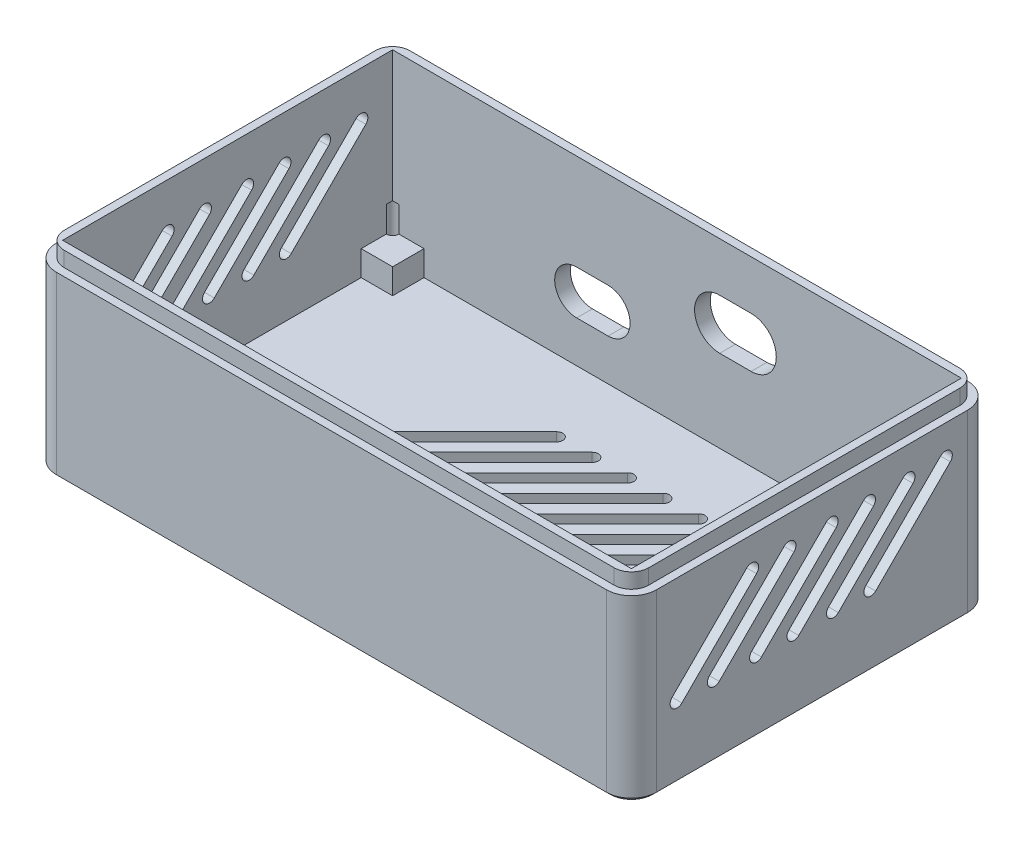
from build123d import *

# Parameters (mm, degrees)
CUERPO_DEPTH                  = 28.5
CROQUIS_HUECO_PCB_W           = 90.5
CROQUIS_HUECO_PCB_H           = 52.5
HUECO_PCB_DEPTH               = 26.5
CROQUIS_LABIO_W               = 90.5
CROQUIS_LABIO_H               = 52.5
LABIO_LIP_DEPTH               = 2.4
CROQUIS_APOYOS_W              = 5
CROQUIS_APOYOS_H              = 5
APOYOS_PCB_DEPTH              = 4
CROQUIS_ALIVIOS_R             = 1
ALIVIOS_ESQUINAS_DEPTH        = 8.1
SALIDAS_USB_Y_PANEL_DEPTH     = 64.729388825
VENTILAS_LATERALES_DEPTH      = 64.729388825
VENTILAS_LATERALES_DEPTH_BACK = 64.729388825
REJILLA_PISO_DEPTH            = 2
CHAFLAN_BASE_SIZE             = 0.6


with BuildPart() as part:
    # Croquis_contorno → Cuerpo (new body)
    with BuildSketch(Plane(origin=(0, 0, 0), x_dir=(1, 0, 0), z_dir=(0, 1, 0))):
        with BuildLine():
            Line((-43.75, -28.75), (43.75, -28.75))
            ThreePointArc((43.75, -28.75), (46.578427125, -27.578427125), (47.75, -24.75))
            Line((47.75, -24.75), (47.75, 24.75))
            ThreePointArc((47.75, 24.75), (46.578427125, 27.578427125), (43.75, 28.75))
            Line((43.75, 28.75), (-43.75, 28.75))
            ThreePointArc((-43.75, 28.75), (-46.578427125, 27.578427125), (-47.75, 24.75))
            Line((-47.75, 24.75), (-47.75, -24.75))
            ThreePointArc((-47.75, -24.75), (-46.578427125, -27.578427125), (-43.75, -28.75))
        make_face()
    extrude(amount=CUERPO_DEPTH)

    # Croquis_hueco_PCB → Hueco_PCB (cut)
    with BuildSketch(Plane(origin=(0, 28.5, 0), x_dir=(1, 0, 0), z_dir=(0, 1, 0))):
        Rectangle(CROQUIS_HUECO_PCB_W, CROQUIS_HUECO_PCB_H)
    extrude(amount=-HUECO_PCB_DEPTH, mode=Mode.SUBTRACT)

    # Croquis_labio → Labio_lip (add)
    with BuildSketch(Plane(origin=(0, 28.5, 0), x_dir=(1, 0, 0), z_dir=(0, 1, 0))):
        with BuildLine():
            Line((-43.75, -27.5), (43.75, -27.5))
            ThreePointArc((43.75, -27.5), (45.694543648, -26.694543648), (46.5, -24.75))
            Line((46.5, -24.75), (46.5, 24.75))
            ThreePointArc((46.5, 24.75), (45.694543648, 26.694543648), (43.75, 27.5))
            Line((43.75, 27.5), (-43.75, 27.5))
            ThreePointArc((-43.75, 27.5), (-45.694543648, 26.694543648), (-46.5, 24.75))
            Line((-46.5, 24.75), (-46.5, -24.75))
            ThreePointArc((-46.5, -24.75), (-45.694543648, -26.694543648), (-43.75, -27.5))
        make_face()
        Rectangle(CROQUIS_LABIO_W, CROQUIS_LABIO_H, mode=Mode.SUBTRACT)
    extrude(amount=LABIO_LIP_DEPTH)

    # Croquis_apoyos → Apoyos_PCB (add)
    with BuildSketch(Plane(origin=(0, 2, 0), x_dir=(1, 0, 0), z_dir=(0, 1, 0))):
        with Locations((-42.75, -23.75)):
            Rectangle(CROQUIS_APOYOS_W, CROQUIS_APOYOS_H)
        with Locations((-42.75, 23.75)):
            Rectangle(CROQUIS_APOYOS_W, CROQUIS_APOYOS_H)
        with Locations((42.75, -23.75)):
            Rectangle(CROQUIS_APOYOS_W, CROQUIS_APOYOS_H)
        with Locations((42.75, 23.75)):
            Rectangle(CROQUIS_APOYOS_W, CROQUIS_APOYOS_H)
    extrude(amount=APOYOS_PCB_DEPTH)

    # Croquis_alivios → Alivios_esquinas (cut)
    with BuildSketch(Plane(origin=(0, 2, 0), x_dir=(1, 0, 0), z_dir=(0, 1, 0))):
        with Locations((-45.25, -26.25)):
            Circle(CROQUIS_ALIVIOS_R)
        with Locations((-45.25, 26.25)):
            Circle(CROQUIS_ALIVIOS_R)
        with Locations((45.25, -26.25)):
            Circle(CROQUIS_ALIVIOS_R)
        with Locations((45.25, 26.25)):
            Circle(CROQUIS_ALIVIOS_R)
    extrude(amount=ALIVIOS_ESQUINAS_DEPTH, mode=Mode.SUBTRACT)

    # Croquis_salidas → Salidas_USB_y_panel (cut, through all)
    with BuildSketch(Plane.XY):
        with BuildLine():
            Line((6.8, 23.1), (11.8, 23.1))
            ThreePointArc((11.8, 23.1), (15.8, 19.1), (11.8, 15.1))
            Line((11.8, 15.1), (6.8, 15.1))
            ThreePointArc((6.8, 15.1), (2.8, 19.1), (6.8, 23.1))
        make_face()
        with BuildLine():
            Line((-15.96, 15.6), (-10.96, 15.6))
            ThreePointArc((-10.96, 15.6), (-7.46, 12.1), (-10.96, 8.6))
            Line((-10.96, 8.6), (-15.96, 8.6))
            ThreePointArc((-15.96, 8.6), (-19.46, 12.1), (-15.96, 15.6))
        make_face()
    extrude(amount=-SALIDAS_USB_Y_PANEL_DEPTH, mode=Mode.SUBTRACT)

    # Croquis_ventilas → Ventilas_laterales (cut, two sides: drawn at the far end of the back side and taken through both)
    with BuildSketch(Plane(origin=(0, 0, 0), x_dir=(0, 0, -1), z_dir=(1, 0, 0)).offset(-VENTILAS_LATERALES_DEPTH_BACK)):
        with BuildLine():
            Line((-22.273863607, 12.438120497), (-10.394469683, 24.317514421))
            ThreePointArc((-10.394469683, 24.317514421), (-8.838834765, 24.317514421), (-8.838834765, 22.761879503))
            Line((-8.838834765, 22.761879503), (-20.718228689, 10.882485579))
            ThreePointArc((-20.718228689, 10.882485579), (-22.273863607, 10.882485579), (-22.273863607, 12.438120497))
        make_face()
        with BuildLine():
            Line((-16.334166645, 12.438120497), (-4.454772721, 24.317514421))
            ThreePointArc((-4.454772721, 24.317514421), (-2.899137803, 24.317514421), (-2.899137803, 22.761879503))
            Line((-2.899137803, 22.761879503), (-14.778531727, 10.882485579))
            ThreePointArc((-14.778531727, 10.882485579), (-16.334166645, 10.882485579), (-16.334166645, 12.438120497))
        make_face()
        with BuildLine():
            Line((-9.616652224, 12.438120497), (2.2627417, 24.317514421))
            ThreePointArc((2.2627417, 24.317514421), (3.818376618, 24.317514421), (3.818376618, 22.761879503))
            Line((3.818376618, 22.761879503), (-8.061017306, 10.882485579))
            ThreePointArc((-8.061017306, 10.882485579), (-9.616652224, 10.882485579), (-9.616652224, 12.438120497))
        make_face()
        with BuildLine():
            Line((-3.676955262, 12.438120497), (8.202438662, 24.317514421))
            ThreePointArc((8.202438662, 24.317514421), (9.75807358, 24.317514421), (9.75807358, 22.761879503))
            Line((9.75807358, 22.761879503), (-2.121320344, 10.882485579))
            ThreePointArc((-2.121320344, 10.882485579), (-3.676955262, 10.882485579), (-3.676955262, 12.438120497))
        make_face()
        with BuildLine():
            Line((2.61629509, 12.438120497), (14.495689014, 24.317514421))
            ThreePointArc((14.495689014, 24.317514421), (16.051323933, 24.317514421), (16.051323933, 22.761879503))
            Line((16.051323933, 22.761879503), (4.171930009, 10.882485579))
            ThreePointArc((4.171930009, 10.882485579), (2.61629509, 10.882485579), (2.61629509, 12.438120497))
        make_face()
        with BuildLine():
            Line((8.555992052, 12.438120497), (20.435385976, 24.317514421))
            ThreePointArc((20.435385976, 24.317514421), (21.991020895, 24.317514421), (21.991020895, 22.761879503))
            Line((21.991020895, 22.761879503), (10.111626971, 10.882485579))
            ThreePointArc((10.111626971, 10.882485579), (8.555992052, 10.882485579), (8.555992052, 12.438120497))
        make_face()
    extrude(amount=VENTILAS_LATERALES_DEPTH + VENTILAS_LATERALES_DEPTH_BACK, mode=Mode.SUBTRACT)

    # Croquis_rejilla_piso → Rejilla_piso (cut)
    with BuildSketch(Plane(origin=(0, 0, 0), x_dir=(1, 0, 0), z_dir=(0, 1, 0))):
        with BuildLine():
            Line((-38.183766184, -14.142135624), (-8.485281374, 15.556349186))
            ThreePointArc((-8.485281374, 15.556349186), (-7.071067812, 15.556349186), (-7.071067812, 14.142135624))
            Line((-7.071067812, 14.142135624), (-36.769552622, -15.556349186))
            ThreePointArc((-36.769552622, -15.556349186), (-38.183766184, -15.556349186), (-38.183766184, -14.142135624))
        make_face()
        with BuildLine():
            Line((-32.526911935, -14.142135624), (-2.828427125, 15.556349186))
            ThreePointArc((-2.828427125, 15.556349186), (-1.414213562, 15.556349186), (-1.414213562, 14.142135624))
            Line((-1.414213562, 14.142135624), (-31.112698372, -15.556349186))
            ThreePointArc((-31.112698372, -15.556349186), (-32.526911935, -15.556349186), (-32.526911935, -14.142135624))
        make_face()
        with BuildLine():
            Line((-26.870057685, -14.142135624), (2.828427125, 15.556349186))
            ThreePointArc((2.828427125, 15.556349186), (4.242640687, 15.556349186), (4.242640687, 14.142135624))
            Line((4.242640687, 14.142135624), (-25.455844123, -15.556349186))
            ThreePointArc((-25.455844123, -15.556349186), (-26.870057685, -15.556349186), (-26.870057685, -14.142135624))
        make_face()
        with BuildLine():
            Line((-21.213203436, -14.142135624), (8.485281374, 15.556349186))
            ThreePointArc((8.485281374, 15.556349186), (9.899494937, 15.556349186), (9.899494937, 14.142135624))
            Line((9.899494937, 14.142135624), (-19.798989873, -15.556349186))
            ThreePointArc((-19.798989873, -15.556349186), (-21.213203436, -15.556349186), (-21.213203436, -14.142135624))
        make_face()
        with BuildLine():
            Line((-15.556349186, -14.142135624), (14.142135624, 15.556349186))
            ThreePointArc((14.142135624, 15.556349186), (15.556349186, 15.556349186), (15.556349186, 14.142135624))
            Line((15.556349186, 14.142135624), (-14.142135624, -15.556349186))
            ThreePointArc((-14.142135624, -15.556349186), (-15.556349186, -15.556349186), (-15.556349186, -14.142135624))
        make_face()
        with BuildLine():
            Line((-9.899494937, -14.142135624), (19.798989873, 15.556349186))
            ThreePointArc((19.798989873, 15.556349186), (21.213203436, 15.556349186), (21.213203436, 14.142135624))
            Line((21.213203436, 14.142135624), (-8.485281374, -15.556349186))
            ThreePointArc((-8.485281374, -15.556349186), (-9.899494937, -15.556349186), (-9.899494937, -14.142135624))
        make_face()
        with BuildLine():
            Line((-4.242640687, -14.142135624), (25.455844123, 15.556349186))
            ThreePointArc((25.455844123, 15.556349186), (26.870057685, 15.556349186), (26.870057685, 14.142135624))
            Line((26.870057685, 14.142135624), (-2.828427125, -15.556349186))
            ThreePointArc((-2.828427125, -15.556349186), (-4.242640687, -15.556349186), (-4.242640687, -14.142135624))
        make_face()
        with BuildLine():
            Line((1.414213562, -14.142135624), (31.112698372, 15.556349186))
            ThreePointArc((31.112698372, 15.556349186), (32.526911935, 15.556349186), (32.526911935, 14.142135624))
            Line((32.526911935, 14.142135624), (2.828427125, -15.556349186))
            ThreePointArc((2.828427125, -15.556349186), (1.414213562, -15.556349186), (1.414213562, -14.142135624))
        make_face()
        with BuildLine():
            Line((7.071067812, -14.142135624), (36.769552622, 15.556349186))
            ThreePointArc((36.769552622, 15.556349186), (38.183766184, 15.556349186), (38.183766184, 14.142135624))
            Line((38.183766184, 14.142135624), (8.485281374, -15.556349186))
            ThreePointArc((8.485281374, -15.556349186), (7.071067812, -15.556349186), (7.071067812, -14.142135624))
        make_face()
    extrude(amount=REJILLA_PISO_DEPTH, mode=Mode.SUBTRACT)

    # Chaflan_base
    chaflan_base_edges = [part.edges().sort_by_distance(p)[0] for p in [
        (0, 0, 28.75),
        (46.578427125, 0, 27.578427125),
        (47.75, 0, 0),
        (46.578427125, 0, -27.578427125),
        (0, 0, -28.75),
        (-46.578427125, 0, -27.578427125),
        (-47.75, 0, 0),
        (-46.578427125, 0, 27.578427125),
    ]]
    chamfer(chaflan_base_edges, length=CHAFLAN_BASE_SIZE)


solid = part.part
